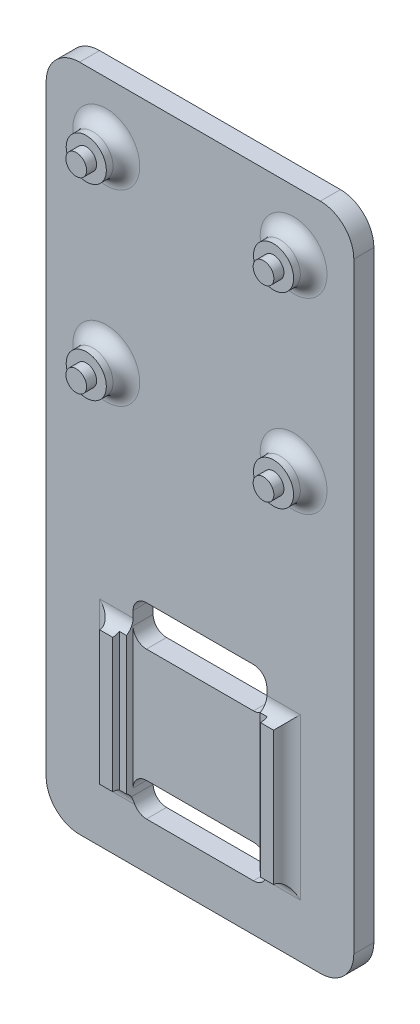
from build123d import *

# Parameters (mm, degrees)
SKETCH_1_W          = 46
SKETCH_1_H          = 100
EXTRUDE_1_DEPTH     = 3
SKETCH_2_R          = 3
EXTRUDE_2_DEPTH     = 3
SKETCH_3_R          = 1.55
EXTRUDE_3_DEPTH     = 1.5
FILLET_1_R          = 2
FILLET_2_R          = 5
SKETCH_4_W          = 2
SKETCH_4_H          = 20
SKETCH_4_W_2        = 1
EXTRUDE_4_DEPTH     = 2
SKETCH_5_W          = 22.1
SKETCH_5_H          = 30
CUT_EXTRUDE_1_DEPTH = 1
FILLET_3_R          = 2
SKETCH_6_W          = 20
SKETCH_6_H          = 6
SKETCH_6_H_2        = 5
CUT_EXTRUDE_2_DEPTH = 10
FILLET_4_R          = 2


with BuildPart() as part:
    # ｽｹｯﾁ1 → ﾎﾞｽ - 押し出し1 (new body)
    with BuildSketch(Plane.XY):
        with Locations((23, 50)):
            Rectangle(SKETCH_1_W, SKETCH_1_H)
    extrude(amount=EXTRUDE_1_DEPTH)

    # ｽｹｯﾁ2 → ﾎﾞｽ - 押し出し2 (add)
    with BuildSketch(Plane.XY.offset(3)):
        with Locations(Location((9, 91, 0), (0, 0, 180))):
            Circle(SKETCH_2_R)
        with Locations(Location((37, 91, 0), (0, 0, 180))):
            Circle(SKETCH_2_R)
        with Locations(Location((9, 63, 0), (0, 0, 180))):
            Circle(SKETCH_2_R)
        with Locations(Location((37, 63, 0), (0, 0, 180))):
            Circle(SKETCH_2_R)
    extrude(amount=EXTRUDE_2_DEPTH)

    # ｽｹｯﾁ3 → ﾎﾞｽ - 押し出し3 (add)
    with BuildSketch(Plane.XY.offset(6)):
        with Locations((9, 91)):
            Circle(SKETCH_3_R)
        with Locations((37, 91)):
            Circle(SKETCH_3_R)
        with Locations((9, 63)):
            Circle(SKETCH_3_R)
        with Locations((37, 63)):
            Circle(SKETCH_3_R)
    extrude(amount=EXTRUDE_3_DEPTH)

    # ﾌｨﾚｯﾄ1
    fillet_1_edges = [part.edges().sort_by_distance(p)[0] for p in [
        (12, 91, 3),
        (40, 91, 3),
        (12, 63, 3),
        (40, 63, 3),
    ]]
    fillet(fillet_1_edges, radius=FILLET_1_R)

    # ﾌｨﾚｯﾄ2
    fillet_2_edges = [part.edges().sort_by_distance(p)[0] for p in [
        (0, 100, 1.5),
        (46, 100, 1.5),
        (46, 0, 1.5),
        (0, 0, 1.5),
    ]]
    fillet(fillet_2_edges, radius=FILLET_2_R)

    # ｽｹｯﾁ4 → ﾎﾞｽ - 押し出し4 (add)
    with BuildSketch(Plane.XY.offset(3)):
        with Locations((11, 20)):
            Rectangle(SKETCH_4_W, SKETCH_4_H)
        with Locations((12.5, 20)):
            Rectangle(SKETCH_4_W_2, SKETCH_4_H)
        with Locations((33.5, 20)):
            Rectangle(SKETCH_4_W_2, SKETCH_4_H)
        with Locations((35, 20)):
            Rectangle(SKETCH_4_W, SKETCH_4_H)
    extrude(amount=EXTRUDE_4_DEPTH)

    # ｽｹｯﾁ5 → ｶｯﾄ - 押し出し1 (cut)
    with BuildSketch(Plane.XY.offset(5)):
        with Locations((23, 20)):
            Rectangle(SKETCH_5_W, SKETCH_5_H)
    extrude(amount=-CUT_EXTRUDE_1_DEPTH, mode=Mode.SUBTRACT)

    # ﾌｨﾚｯﾄ3
    fillet_3_edges = [part.edges().sort_by_distance(p)[0] for p in [
        (11.5, 30, 3),
    ]]
    fillet(fillet_3_edges, radius=FILLET_3_R - 0.0001)  # a hair under: the kernel refuses the full size
    fillet_3_2_edges = [part.edges().sort_by_distance(p)[0] for p in [
        (10, 20, 3),
    ]]
    fillet(fillet_3_2_edges, radius=FILLET_3_R - 0.0001)  # a hair under: the kernel refuses the full size
    fillet_3_3_edges = [part.edges().sort_by_distance(p)[0] for p in [
        (11.5, 10, 3),
    ]]
    fillet(fillet_3_3_edges, radius=FILLET_3_R - 0.0001)  # a hair under: the kernel refuses the full size
    fillet_3_4_edges = [part.edges().sort_by_distance(p)[0] for p in [
        (34.5, 30, 3),
    ]]
    fillet(fillet_3_4_edges, radius=FILLET_3_R - 0.0004)  # a hair under: the kernel refuses the full size
    fillet_3_5_edges = [part.edges().sort_by_distance(p)[0] for p in [
        (34.5, 10, 3),
    ]]
    fillet(fillet_3_5_edges, radius=FILLET_3_R - 0.0004)  # a hair under: the kernel refuses the full size
    fillet_3_6_edges = [part.edges().sort_by_distance(p)[0] for p in [
        (36, 20, 3),
    ]]
    fillet(fillet_3_6_edges, radius=FILLET_3_R - 0.0004)  # a hair under: the kernel refuses the full size

    # ｽｹｯﾁ6 → ｶｯﾄ - 押し出し2 (cut)
    with BuildSketch(Plane.XY.offset(3)):
        with Locations((23, 32)):
            Rectangle(SKETCH_6_W, SKETCH_6_H)
        with Locations((23, 9.5)):
            Rectangle(SKETCH_6_W, SKETCH_6_H_2)
    extrude(amount=-CUT_EXTRUDE_2_DEPTH, mode=Mode.SUBTRACT)

    # ﾌｨﾚｯﾄ4
    fillet_4_edges = [part.edges().sort_by_distance(p)[0] for p in [
        (13, 29, 1.5),
        (13, 35, 1.5),
        (33, 35, 1.5),
        (33, 29, 1.5),
        (13, 7, 1.5),
        (13, 12, 1.5),
        (33, 12, 1.5),
        (33, 7, 1.5),
    ]]
    fillet(fillet_4_edges, radius=FILLET_4_R)


solid = part.part
